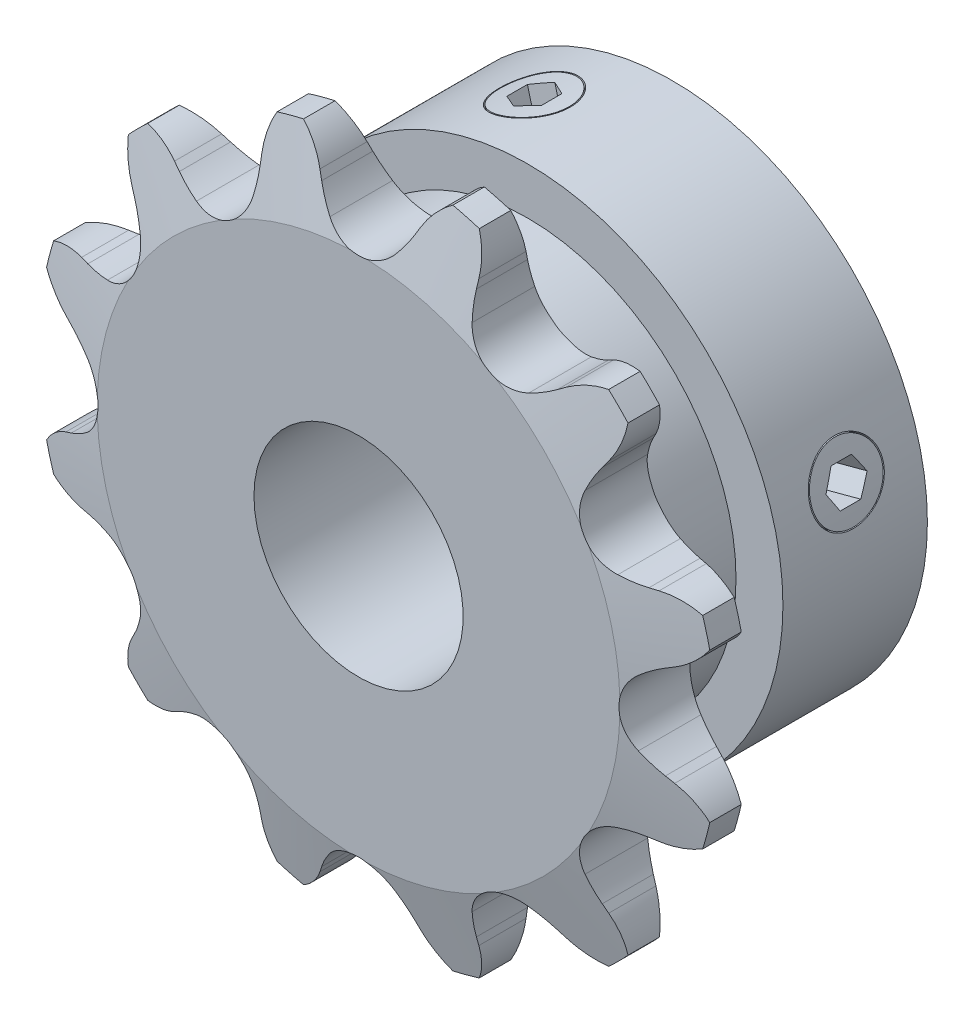
from build123d import *

# Parameters (mm, degrees)
TOOTH_CUT_NUMBER_OF_TEETH_12_DEPTH = 30.256029686
TOOTH_PATTERN_12_12_COUNT          = 12
SKETCH5_R                          = 6.35
CUT_EXTRUDE1_DEPTH                 = 35.250925722
CUT_EXTRUDE2_DEPTH                 = 35.250925722
SKETCH7_R                          = 2.098674941
CUT_EXTRUDE3_DEPTH                 = 40.20706721
CUT_EXTRUDE3_DRAFT                 = 1
EXTRUDE1_REACH                     = 41.207
EXTRUDE1_END_RADIUS                = 15.478759348
SKETCH8_R                          = 2.164801051
CUT_EXTRUDE4_START                 = -1.27
CUT_EXTRUDE4_DEPTH                 = 38.937067253
CIRPATTERN1_START                  = 9.005861062
CIRPATTERN1_DEPTH                  = 6.472898286
EXTRUDE2_DEPTH                     = 19.05


# Read off the part's stored shape, not the designer's step: CirPattern1
with BuildPart() as part:
    # Sprocket-BaseSketch → 35 (06C) ANSI (ISO) Chain Number, 1.449in P.D. (revolve)
    with BuildSketch(Plane(origin=(0, 0, 0), x_dir=(0, 0, -1), z_dir=(1, 0, 0)), mode=Mode.PRIVATE) as f_35_06c_ansi_iso_chain_number_1_449i_sk:
        Polygon((2.1463, 0), (2.1463, 15.868891971), (0.955675, 20.631391971), (-0.955675, 20.631391971), (-2.1463, 15.868891971), (-2.1463, 0), align=None)
    revolve(f_35_06c_ansi_iso_chain_number_1_449i_sk.sketch.rotate(Axis((0, 0, -8.5852), (0, 0, 1)), 90), axis=Axis((0, 0, -8.5852), (0, 0, 1)))

    # Tooth-Sketch → Tooth-Cut, Number of teeth: 12 (cut, symmetric)
    with BuildSketch(Plane.XY):
        with BuildLine():
            Line((2.833741878, 18.026507052), (3.058567143, 18.474170961))
            ThreePointArc((3.058567143, 18.474170961), (4.630783806, 20.18994437), (6.869664477, 20.824890798))
            ThreePointArc((6.869664477, 20.824890798), (0, 21.928711015), (-6.869664477, 20.824890798))
            ThreePointArc((-6.869664477, 20.824890798), (-4.630783806, 20.18994437), (-3.058567143, 18.474170961))
            Line((-3.058567143, 18.474170961), (-2.833741878, 18.026507052))
            ThreePointArc((-2.833741878, 18.026507052), (-2.446799671, 17.356303489), (-1.984667943, 16.735552852))
            ThreePointArc((-1.984667943, 16.735552852), (0, 15.810086991), (1.984667943, 16.735552852))
            ThreePointArc((1.984667943, 16.735552852), (2.446799671, 17.356303489), (2.833741878, 18.026507052))
        make_face()
    tooth_cut_number_of_teeth_12 = extrude(amount=TOOTH_CUT_NUMBER_OF_TEETH_12_DEPTH, both=True, mode=Mode.SUBTRACT)

    # Tooth Pattern, 12 / 12: Tooth-Cut, Number of teeth: 12 ×12 about axis
    tooth_pattern_12_12_axis = Axis((0, 0, 0), (0, 0, 1))
    for i in range(1, TOOTH_PATTERN_12_12_COUNT):
        add(tooth_cut_number_of_teeth_12.rotate(tooth_pattern_12_12_axis, i * 360 / TOOTH_PATTERN_12_12_COUNT), mode=Mode.SUBTRACT)

    # Sketch3 → Hub-Revolve1 (revolve)
    with BuildSketch(Plane(origin=(0, 0, 0), x_dir=(0, 0, -1), z_dir=(1, 0, 0)), mode=Mode.PRIVATE) as hub_revolve1_sk:
        Polygon((2.1463, 0), (2.1463, 12.630391997), (8.134350118, 12.630391997), (8.134350118, 15.478759348), (16.9037, 15.478759348), (16.9037, 0), align=None)
    revolve(hub_revolve1_sk.sketch.rotate(Axis((0, 0, 14.7574), (0, 0, -1)), 90), axis=Axis((0, 0, 14.7574), (0, 0, -1)))

    # Sketch5 → Cut-Extrude1 (cut, through all)
    with BuildSketch(Plane(origin=(0, 0, -16.9037), x_dir=(-1, 0, 0), z_dir=(0, 0, -1))):
        Circle(SKETCH5_R)
    extrude(amount=-CUT_EXTRUDE1_DEPTH, mode=Mode.SUBTRACT)

    # Sketch6 → Cut-Extrude2 (cut, through all)
    with BuildSketch(Plane(origin=(0, 0, -16.9037), x_dir=(-1, 0, 0), z_dir=(0, 0, -1))):
        Polygon((0.05790569, 6.349735973), (3.124720188, 5.527985505), (3.535595422, 7.061392754), (0.468780924, 7.883143223), align=None)
    extrude(amount=-CUT_EXTRUDE2_DEPTH, mode=Mode.SUBTRACT)


with BuildPart() as cut_extrude3_tool:
    # Sketch7 → Cut-Extrude3 (with draft: the straight prism first)
    with BuildSketch(Plane(origin=(-2.002188173, 7.472267988, 0), x_dir=(0.9659258262890683, 0.25881904510252113, 0), z_dir=(0.25881904510252113, -0.9659258262890683, 0))):
        with Locations((0, -12.519025059)):
            Circle(SKETCH7_R)
    extrude(amount=-CUT_EXTRUDE3_DEPTH)
    # Cut-Extrude3: the draft: its side faces are tilted about the plane it starts from
    cut_extrude3_sides = [cut_extrude3_tool.faces().sort_by_distance(p)[0] for p in [
        (-9.23252987, 26.347613253, -12.519025059),
    ]]
    draft(cut_extrude3_sides, Plane(origin=(-2.002188173, 7.472267988, 0), x_dir=(0.9659258262890683, 0.25881904510252113, 0), z_dir=(0.25881904510252113, -0.9659258262890683, 0)), CUT_EXTRUDE3_DRAFT)


with BuildPart() as part_1:
    add(part.part)

    # Cut-Extrude3: cut by cut_extrude3_tool
    add(cut_extrude3_tool.part, mode=Mode.SUBTRACT)

    # Extrude1: up to this cylinder (the profile starts inside it)
    extrude1_end = Plane(origin=(0, 0, -12.519025), z_dir=(0, 0, 1)) * Cylinder(EXTRUDE1_END_RADIUS, 114.371518697, mode=Mode.PRIVATE)
    # Sketch8 → Extrude1 (add, up to the surface)
    with BuildSketch(Plane(origin=(-2.002188173, 7.472267988, 0), x_dir=(0.9659258262890683, 0.25881904510252113, 0), z_dir=(0.25881904510252113, -0.9659258262890683, 0)), mode=Mode.PRIVATE) as extrude1_sk1:
        with Locations((0, -12.519025059)):
            Circle(SKETCH8_R)
    extrude1_tool1 = extrude(extrude1_sk1.sketch, amount=-EXTRUDE1_REACH, mode=Mode.PRIVATE) & extrude1_end
    add(extrude1_tool1.solids().sort_by_distance((-2.002188, 7.472268, -12.519025))[0])

    # Sketch9 → Cut-Extrude4 (cut, through all)
    with BuildSketch(Plane(origin=(-2.002188173, 7.472267988, 0), x_dir=(0.9659258262890683, 0.25881904510252113, 0), z_dir=(0.25881904510252113, -0.9659258262890683, 0)).offset(CUT_EXTRUDE4_START)):
        Polygon((0, -13.768873529), (1.082400526, -13.143949294), (1.082400526, -11.894100824), (0, -11.269176589), (-1.082400526, -11.894100824), (-1.082400526, -13.143949294), align=None)
    extrude(amount=-CUT_EXTRUDE4_DEPTH, mode=Mode.SUBTRACT)

    # CirPattern1 outline → CirPattern1 (cut)
    with BuildSketch(Plane(origin=(0, 0, 0), x_dir=(-0.25881904510251813, 0.9659258262890691, 0), z_dir=(0.9659258262890691, 0.2588190451025181, 0)).offset(CIRPATTERN1_START)):
        Polygon((-1.082400526, -13.143949294), (0, -13.768873529), (1.082400526, -13.143949294), (1.082400526, -11.894100824), (0, -11.269176589), (-1.082400526, -11.894100824), align=None)
    extrude(amount=CIRPATTERN1_DEPTH, mode=Mode.SUBTRACT)

    # CirPattern1 2 outline → CirPattern1 2 (revolve, cut)
    with BuildSketch(Plane(origin=(0, 0, -12.519025059), x_dir=(-0.25881904510251813, 0.9659258262890691, 0), z_dir=(0, 0, -1))):
        Polygon((2.164801051, 15.478781306), (2.164801051, 11.524223385), (2.233828848, 15.478823236), align=None)
    revolve(axis=Axis((0, 0, -12.519025059), (0.9659258262890693, 0.2588190451025182, 0)), mode=Mode.SUBTRACT)

    # Sketch11 → Extrude2 (add)
    with BuildSketch(Plane(origin=(0, 0, -16.9037), x_dir=(-1, 0, 0), z_dir=(0, 0, -1))):
        with BuildLine():
            Line((0.468780924, 7.883143223), (0.05790569, 6.349735973))
            ThreePointArc((0.05790569, 6.349735973), (1.643500936, 6.133628997), (3.124720188, 5.527985505))
            Line((3.124720188, 5.527985505), (3.535595422, 7.061392754))
            Line((3.535595422, 7.061392754), (0.468780924, 7.883143223))
        make_face()
    extrude(amount=-EXTRUDE2_DEPTH)


solid = part_1.part
